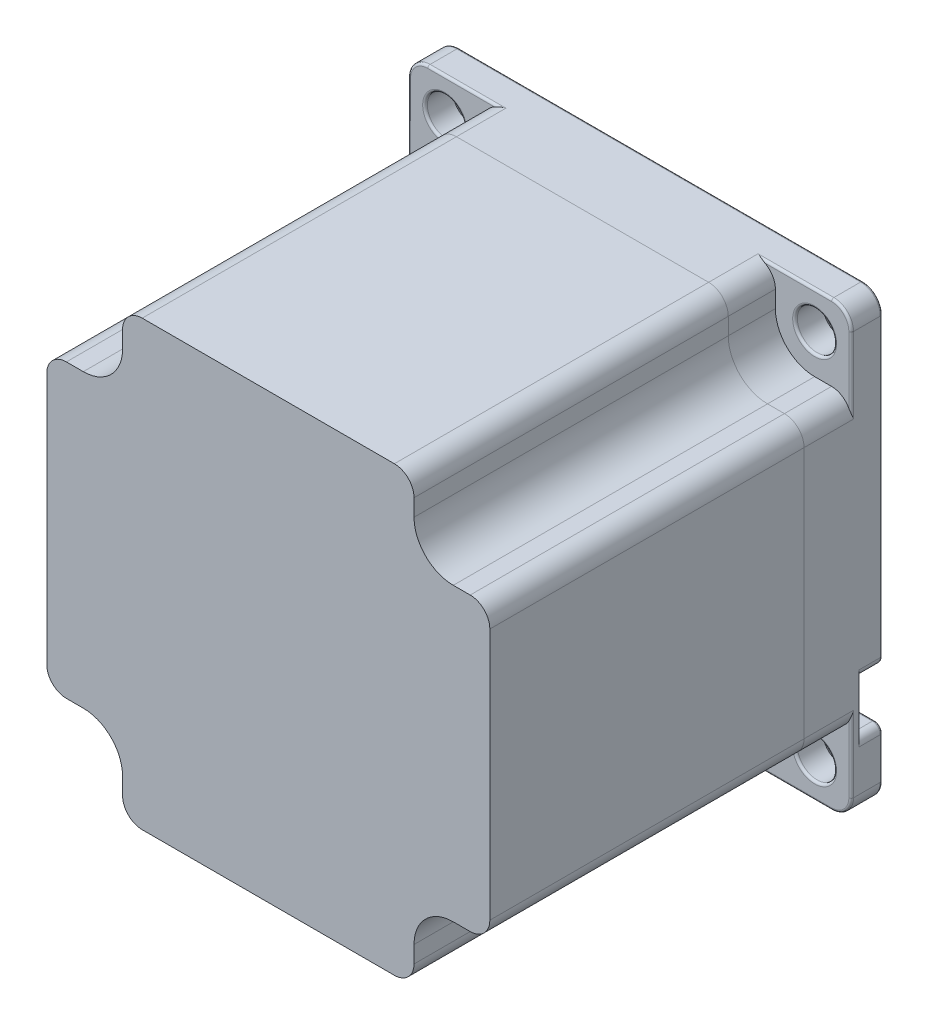
from build123d import *

# Parameters (mm, degrees)
SKETCH_1_W          = 56.4
SKETCH_1_H          = 56.4
EXTRUDE_1_DEPTH     = 10
SKETCH_2_R          = 2.5
CUT_EXTRUDE_1_DEPTH = 42.115447219
CUT_EXTRUDE_2_DEPTH = 6
FILLET_1_R          = 2.5
SKETCH_4_R          = 19.05
EXTRUDE_2_DEPTH     = 1.6
SKETCH_5_R          = 3.175
EXTRUDE_3_DEPTH     = 20.6
CUT_EXTRUDE_START   = -2.5
SKETCH_6_R          = 5.5
SKETCH_6_R_2        = 3.175
CUT_EXTRUDE_3_DEPTH = 2.5
CHAMFER_1_SIZE      = 0.5
SKETCH_7_R          = 1
CUT_EXTRUDE_4_DEPTH = 3
CUT_EXTRUDE_5_DEPTH = 3
FILLET_2_R          = 1
EXTRUDE_5_DEPTH     = 54
EXTRUDE_6_DEPTH     = 11
FILLET_7_R          = 0.5
SKETCH_14_R         = 5.5
CUT_EXTRUDE_8_DEPTH = 4
SKETCH_15_R         = 3.25
EXTRUDE_7_DEPTH     = 1
CUT_EXTRUDE_START_2 = -3
SKETCH_16_R         = 1
CUT_EXTRUDE_9_DEPTH = 3
CHAMFER_3_SIZE      = 1
FILLET_8_R          = 0.5
FILLET_9_R          = 0.3
SKETCH2_W           = 73.4450425
SKETCH2_H           = 31.151425638
CUT_EXTRUDE1_DEPTH  = 98.985713331


with BuildPart() as part:
    # Эскиз1 → Бобышка-Вытянуть1 (new body)
    with BuildSketch(Plane.XY):
        Rectangle(SKETCH_1_W, SKETCH_1_H)
    extrude(amount=EXTRUDE_1_DEPTH)

    # Эскиз2 → Вырез-Вытянуть1 (cut, through all)
    with BuildSketch(Plane.XY.offset(10)):
        with Locations((-23.55, 23.55)):
            Circle(SKETCH_2_R)
        with Locations((23.55, 23.55)):
            Circle(SKETCH_2_R)
        with Locations((23.55, -23.55)):
            Circle(SKETCH_2_R)
        with Locations((-23.55, -23.55)):
            Circle(SKETCH_2_R)
    extrude(amount=-CUT_EXTRUDE_1_DEPTH, mode=Mode.SUBTRACT)

    # Эскиз3 → Вырез-Вытянуть2 (cut)
    with BuildSketch(Plane.XY.offset(10)):
        with BuildLine():
            Line((-18.55, 23.55), (-18.55, 28.2))
            Line((-18.55, 28.2), (-28.2, 28.2))
            Line((-28.2, 28.2), (-28.2, 18.55))
            Line((-28.2, 18.55), (-23.55, 18.55))
            ThreePointArc((-23.55, 18.55), (-20.014466094, 20.014466094), (-18.55, 23.55))
        make_face()
        with BuildLine():
            Line((18.55, 23.55), (18.55, 28.2))
            Line((18.55, 28.2), (28.2, 28.2))
            Line((28.2, 28.2), (28.2, 18.55))
            Line((28.2, 18.55), (23.55, 18.55))
            ThreePointArc((23.55, 18.55), (20.014466094, 20.014466094), (18.55, 23.55))
        make_face()
        with BuildLine():
            Line((18.55, -23.55), (18.55, -28.2))
            Line((18.55, -28.2), (28.2, -28.2))
            Line((28.2, -28.2), (28.2, -18.55))
            Line((28.2, -18.55), (23.55, -18.55))
            ThreePointArc((23.55, -18.55), (20.014466094, -20.014466094), (18.55, -23.55))
        make_face()
        with BuildLine():
            Line((-23.55, -18.55), (-28.2, -18.55))
            Line((-28.2, -18.55), (-28.2, -28.2))
            Line((-28.2, -28.2), (-18.55, -28.2))
            Line((-18.55, -28.2), (-18.55, -23.55))
            ThreePointArc((-18.55, -23.55), (-20.014466094, -20.014466094), (-23.55, -18.55))
        make_face()
    extrude(amount=-CUT_EXTRUDE_2_DEPTH, mode=Mode.SUBTRACT)

    # Скругление1
    fillet_1_edges = [part.edges().sort_by_distance(p)[0] for p in [
        (-28.2, 28.2, 2),
        (-28.2, 18.55, 7),
        (-18.55, 28.2, 7),
        (28.2, 28.2, 2),
        (18.55, 28.2, 7),
        (28.2, 18.55, 7),
        (28.2, -28.2, 2),
        (28.2, -18.55, 7),
        (18.55, -28.2, 7),
        (-28.2, -28.2, 2),
        (-18.55, -28.2, 7),
        (-28.2, -18.55, 7),
    ]]
    fillet(fillet_1_edges, radius=FILLET_1_R)

    # Эскиз4 → Бобышка-Вытянуть2 (add)
    with BuildSketch(Plane(origin=(0, 0, 0), x_dir=(-1, 0, 0), z_dir=(0, 0, -1))):
        Circle(SKETCH_4_R)
    extrude(amount=EXTRUDE_2_DEPTH)

    # Эскиз5 → Бобышка-Вытянуть3 (add)
    with BuildSketch(Plane(origin=(0, 0, 0), x_dir=(-1, 0, 0), z_dir=(0, 0, -1))):
        with Locations(Location((0, 0, 0), (0, 0, 180))):
            Circle(SKETCH_5_R)
    extrude(amount=EXTRUDE_3_DEPTH)

    # Эскиз6 → Вырез-Вытянуть3 (cut)
    with BuildSketch(Plane(origin=(0, 0, -1.6), x_dir=(-1, 0, 0), z_dir=(0, 0, -1)).offset(CUT_EXTRUDE_START)):
        Circle(SKETCH_6_R)
        with Locations(Location((0, 0, 0), (0, 0, 180))):
            Circle(SKETCH_6_R_2, mode=Mode.SUBTRACT)
    extrude(amount=CUT_EXTRUDE_3_DEPTH, mode=Mode.SUBTRACT)

    # Фаска1
    chamfer_1_edges = [part.edges().sort_by_distance(p)[0] for p in [
        (-26.05, 23.55, 0),
        (21.05, 23.55, 0),
        (-3.175, 0, -20.6),
        (21.05, -23.55, 0),
        (-26.05, -23.55, 0),
    ]]
    chamfer(chamfer_1_edges, length=CHAMFER_1_SIZE)

    # Эскиз7 → Вырез-Вытянуть4 (cut)
    with BuildSketch(Plane(origin=(0, 0, -20.6), x_dir=(-1, 0, 0), z_dir=(0, 0, -1))):
        Circle(SKETCH_7_R)
    extrude(amount=-CUT_EXTRUDE_4_DEPTH, mode=Mode.SUBTRACT)

    # Эскиз8 → Вырез-Вытянуть5 (cut)
    with BuildSketch(Plane(origin=(0, 0, 0), x_dir=(-1, 0, 0), z_dir=(0, 0, -1))):
        with BuildLine():
            Line((-28.2, -12.95), (-25.45, -12.95))
            ThreePointArc((-25.45, -12.95), (-22.2, -16.2), (-25.45, -19.45))
            Line((-25.45, -19.45), (-28.2, -19.45))
            ThreePointArc((-28.2, -19.45), (-31.45, -16.2), (-28.2, -12.95))
        make_face()
    extrude(amount=-CUT_EXTRUDE_5_DEPTH, mode=Mode.SUBTRACT)

    # Скругление2
    fillet_2_edges = [part.edges().sort_by_distance(p)[0] for p in [
        (28.2, -19.45, 1.5),
        (28.2, -12.95, 1.5),
    ]]
    fillet(fillet_2_edges, radius=FILLET_2_R)

    # Скругление9
    fillet_9_edges = [part.edges().sort_by_distance(p)[0] for p in [
        (28.2, -20.875, 4),
        (28.2, -23.075, 0),
        (0, -28.2, 0),
        (-28.2, 0, 0),
        (0, 28.2, 0),
        (27.467766953, 27.467766953, 0),
        (-27.467766953, 27.467766953, 0),
        (-27.467766953, -27.467766953, 0),
        (27.467766953, -27.467766953, 0),
        (-20.875, -28.2, 4),
        (27.467766953, -27.467766953, 4),
        (-28.2, 20.875, 4),
        (-27.467766953, -27.467766953, 4),
        (20.875, 28.2, 4),
        (-27.467766953, 27.467766953, 4),
        (27.467766953, 27.467766953, 4),
        (19.05, 0, 0),
        (19.05, 0, -1.6),
        (5.5, 0, -1.6),
        (26.325, -12.95, 0),
        (22.2, -16.2, 0),
        (26.325, -19.45, 0),
        (28.2, 6.875, 0),
        (27.907106781, -12.657106781, 0),
        (27.907106781, -19.742893219, 0),
        (-20.875, 28.2, 4),
        (-26.05, 23.55, 4),
        (28.2, 20.875, 4),
        (21.05, 23.55, 4),
        (20.875, -28.2, 4),
        (21.05, -23.55, 4),
        (-28.2, -20.875, 4),
        (-26.05, -23.55, 4),
    ]]
    fillet(fillet_9_edges, radius=FILLET_9_R)


with BuildPart() as body_2:
    # Эскиз11 → Бобышка-Вытянуть5 (new body)
    with BuildSketch(Plane.XY.offset(10)):
        with BuildLine():
            Line((23.55, -18.55), (25.7, -18.55))
            ThreePointArc((25.7, -18.55), (27.467766953, -17.817766953), (28.2, -16.05))
            Line((28.2, -16.05), (28.2, 16.05))
            ThreePointArc((28.2, 16.05), (27.467766953, 17.817766953), (25.7, 18.55))
            Line((25.7, 18.55), (23.55, 18.55))
            ThreePointArc((23.55, 18.55), (20.014466094, 20.014466094), (18.55, 23.55))
            Line((18.55, 23.55), (18.55, 25.7))
            ThreePointArc((18.55, 25.7), (17.817766953, 27.467766953), (16.05, 28.2))
            Line((16.05, 28.2), (-16.05, 28.2))
            ThreePointArc((-16.05, 28.2), (-17.817766953, 27.467766953), (-18.55, 25.7))
            Line((-18.55, 25.7), (-18.55, 23.55))
            ThreePointArc((-18.55, 23.55), (-20.014466094, 20.014466094), (-23.55, 18.55))
            Line((-23.55, 18.55), (-25.7, 18.55))
            ThreePointArc((-25.7, 18.55), (-27.467766953, 17.817766953), (-28.2, 16.05))
            Line((-28.2, 16.05), (-28.2, -16.05))
            ThreePointArc((-28.2, -16.05), (-27.467766953, -17.817766953), (-25.7, -18.55))
            Line((-25.7, -18.55), (-23.55, -18.55))
            ThreePointArc((-23.55, -18.55), (-20.014466094, -20.014466094), (-18.55, -23.55))
            Line((-18.55, -23.55), (-18.55, -25.7))
            ThreePointArc((-18.55, -25.7), (-17.817766953, -27.467766953), (-16.05, -28.2))
            Line((-16.05, -28.2), (16.05, -28.2))
            ThreePointArc((16.05, -28.2), (17.817766953, -27.467766953), (18.55, -25.7))
            Line((18.55, -25.7), (18.55, -23.55))
            ThreePointArc((18.55, -23.55), (20.014466094, -20.014466094), (23.55, -18.55))
        make_face()
    extrude(amount=EXTRUDE_5_DEPTH)


with BuildPart() as body_3:
    # Эскиз12 → Бобышка-Вытянуть6 (new body)
    with BuildSketch(Plane.XY.offset(64)):
        with BuildLine():
            Line((23.55, -18.55), (25.7, -18.55))
            ThreePointArc((25.7, -18.55), (27.467766953, -17.817766953), (28.2, -16.05))
            Line((28.2, -16.05), (28.2, 16.05))
            ThreePointArc((28.2, 16.05), (27.467766953, 17.817766953), (25.7, 18.55))
            Line((25.7, 18.55), (23.55, 18.55))
            ThreePointArc((23.55, 18.55), (20.014466094, 20.014466094), (18.55, 23.55))
            Line((18.55, 23.55), (18.55, 25.7))
            ThreePointArc((18.55, 25.7), (17.817766953, 27.467766953), (16.05, 28.2))
            Line((16.05, 28.2), (-16.05, 28.2))
            ThreePointArc((-16.05, 28.2), (-17.817766953, 27.467766953), (-18.55, 25.7))
            Line((-18.55, 25.7), (-18.55, 23.55))
            ThreePointArc((-18.55, 23.55), (-20.014466094, 20.014466094), (-23.55, 18.55))
            Line((-23.55, 18.55), (-25.7, 18.55))
            ThreePointArc((-25.7, 18.55), (-27.467766953, 17.817766953), (-28.2, 16.05))
            Line((-28.2, 16.05), (-28.2, -16.05))
            ThreePointArc((-28.2, -16.05), (-27.467766953, -17.817766953), (-25.7, -18.55))
            Line((-25.7, -18.55), (-23.55, -18.55))
            ThreePointArc((-23.55, -18.55), (-20.014466094, -20.014466094), (-18.55, -23.55))
            Line((-18.55, -23.55), (-18.55, -25.7))
            ThreePointArc((-18.55, -25.7), (-17.817766953, -27.467766953), (-16.05, -28.2))
            Line((-16.05, -28.2), (16.05, -28.2))
            ThreePointArc((16.05, -28.2), (17.817766953, -27.467766953), (18.55, -25.7))
            Line((18.55, -25.7), (18.55, -23.55))
            ThreePointArc((18.55, -23.55), (20.014466094, -20.014466094), (23.55, -18.55))
        make_face()
    extrude(amount=EXTRUDE_6_DEPTH)

    # Скругление7
    fillet_7_edges = [body_3.edges().sort_by_distance(p)[0] for p in [
        (27.467766953, -17.817766953, 75),
        (28.2, 0, 75),
        (27.467766953, 17.817766953, 75),
        (24.625, 18.55, 75),
        (20.014466094, 20.014466094, 75),
        (18.55, 24.625, 75),
        (17.817766953, 27.467766953, 75),
        (0, 28.2, 75),
        (-17.817766953, 27.467766953, 75),
        (-18.55, 24.625, 75),
        (20.014466094, -20.014466094, 75),
        (-20.014466094, 20.014466094, 75),
        (-24.625, 18.55, 75),
        (-27.467766953, 17.817766953, 75),
        (-28.2, 0, 75),
        (-27.467766953, -17.817766953, 75),
        (-24.625, -18.55, 75),
        (-20.014466094, -20.014466094, 75),
        (-18.55, -24.625, 75),
        (-17.817766953, -27.467766953, 75),
        (0, -28.2, 75),
        (24.625, -18.55, 75),
        (17.817766953, -27.467766953, 75),
        (18.55, -24.625, 75),
    ]]
    fillet(fillet_7_edges, radius=FILLET_7_R)

    # Эскиз14 → Вырез-Вытянуть8 (cut)
    with BuildSketch(Plane.XY.offset(75)):
        with Locations(Location((0, 0, 0), (0, 0, 180))):
            Circle(SKETCH_14_R)
    extrude(amount=-CUT_EXTRUDE_8_DEPTH, mode=Mode.SUBTRACT)

    # Эскиз15 → Бобышка-Вытянуть7 (add)
    with BuildSketch(Plane.XY.offset(71)):
        Circle(SKETCH_15_R)
    extrude(amount=EXTRUDE_7_DEPTH)

    # Эскиз16 → Вырез-Вытянуть9 (cut)
    with BuildSketch(Plane.XY.offset(72).offset(CUT_EXTRUDE_START_2)):
        with Locations(Location((0, 0, 0), (0, 0, 180))):
            Circle(SKETCH_16_R)
    extrude(amount=CUT_EXTRUDE_9_DEPTH, mode=Mode.SUBTRACT)

    # Фаска3
    chamfer_3_edges = [body_3.edges().sort_by_distance(p)[0] for p in [
        (-3.25, 0, 71),
    ]]
    chamfer(chamfer_3_edges, length=CHAMFER_3_SIZE - 0.0001)  # a hair under: the kernel refuses the full size

    # Скругление8
    fillet_8_edges = [body_3.edges().sort_by_distance(p)[0] for p in [
        (5.5, 0, 75),
    ]]
    fillet(fillet_8_edges, radius=FILLET_8_R)


with BuildPart() as cut_extrude1_tool:
    # Sketch2 → Cut-Extrude1 (new, through all)
    with BuildSketch(Plane.XZ.offset(28.2)):
        with Locations((-0.540045897, 65.575712819)):
            Rectangle(SKETCH2_W, SKETCH2_H)
    extrude(amount=-CUT_EXTRUDE1_DEPTH)


with BuildPart() as body_2_1:
    add(body_2.part)

    # Cut-Extrude1: cut by cut_extrude1_tool
    add(cut_extrude1_tool.part, mode=Mode.SUBTRACT)


with BuildPart() as body_3_1:
    add(body_3.part)

    # Cut-Extrude1: cut by cut_extrude1_tool
    add(cut_extrude1_tool.part, mode=Mode.SUBTRACT)


solid = Compound([part.part, body_2_1.part])
